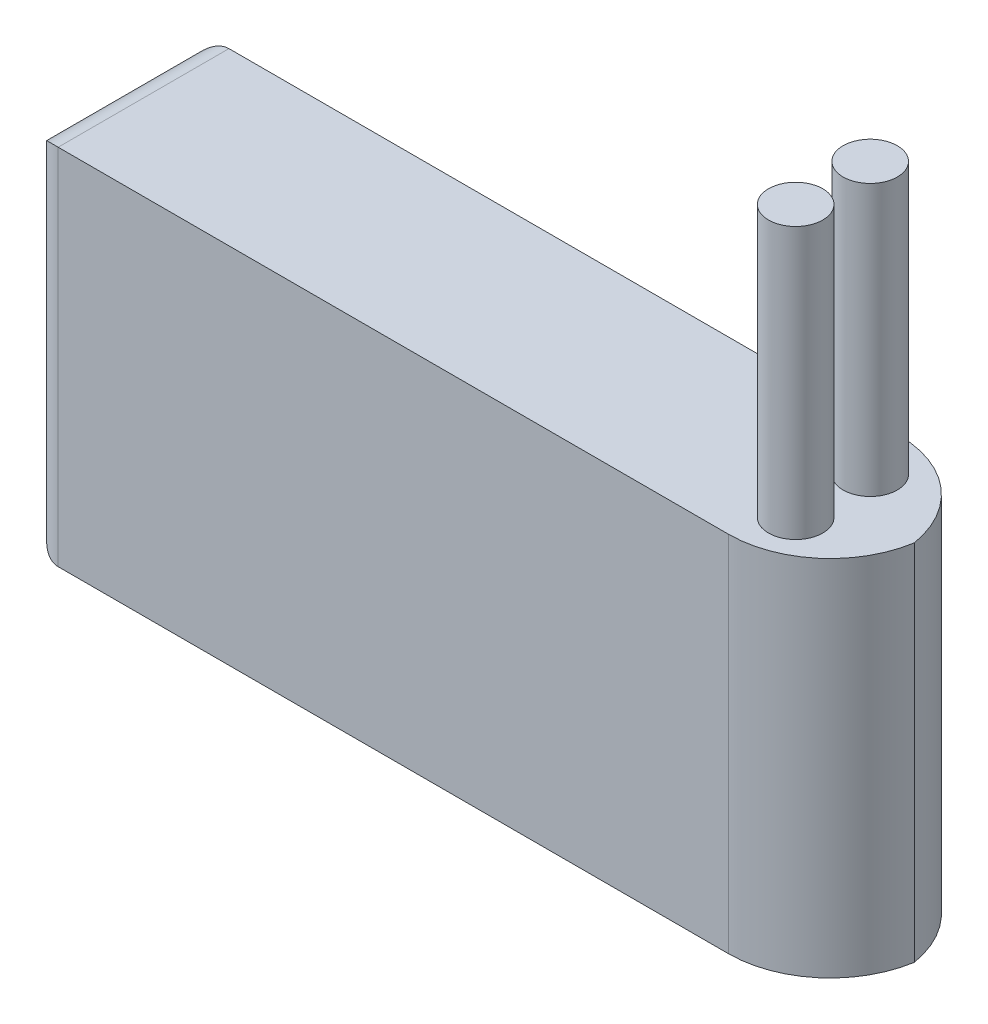
from build123d import *

# Parameters (mm, degrees)
SKETCH1_W           = 74.93
SKETCH1_H           = 34.036
BOSS_EXTRUDE1_DEPTH = 16.002
FILLET1_R           = 9.525
SKETCH2_R           = 2.54
BOSS_EXTRUDE2_DEPTH = 25.4
FILLET2_R           = 2.6035


with BuildPart() as part:
    # Sketch1 → Boss-Extrude1 (new body)
    with BuildSketch(Plane.XY):
        with Locations((37.465, 17.018)):
            Rectangle(SKETCH1_W, SKETCH1_H)
    extrude(amount=BOSS_EXTRUDE1_DEPTH)

    # Fillet1
    # the kernel refuses this fillet: 9.525 mm, written as the material it takes off along each edge
    with BuildSketch(Plane(origin=(74.93, -23.8125, 16.002), x_dir=(0, 0, -1), z_dir=(0, 1, 0))) as fillet1_piece_1:
        with BuildLine():
            CenterArc((FILLET1_R, FILLET1_R), FILLET1_R, 180, 90)
            Line((0, FILLET1_R), (0, 0))
            Line((0, 0), (FILLET1_R, 0))
        make_face()
    extrude(amount=81.661, mode=Mode.SUBTRACT)
    with BuildSketch(Plane(origin=(74.93, -23.8125, 0), x_dir=(0, 0, 1), z_dir=(0, 1, 0))) as fillet1_piece_2:
        with BuildLine():
            CenterArc((FILLET1_R, -FILLET1_R), FILLET1_R, 90, 90)
            Line((0, -FILLET1_R), (0, 0))
            Line((0, 0), (FILLET1_R, 0))
        make_face()
    extrude(amount=81.661, mode=Mode.SUBTRACT)

    # Sketch2 → Boss-Extrude2 (add)
    with BuildSketch(Plane(origin=(0, 34.036, 0), x_dir=(1, 0, 0), z_dir=(0, 1, 0))):
        with Locations(Location((67.187289562, -4.5085, 0), (0, 0, 90))):
            Circle(SKETCH2_R)
        with Locations(Location((67.187289562, -11.4935, 0), (0, 0, 90))):
            Circle(SKETCH2_R)
    extrude(amount=BOSS_EXTRUDE2_DEPTH)

    # Fillet2
    fillet2_edges = [part.edges().sort_by_distance(p)[0] for p in [
        (0, 17.018, 16.002),
        (0, 17.018, 0),
        (0, 34.036, 8.001),
        (0, 0, 8.001),
    ]]
    fillet(fillet2_edges, radius=FILLET2_R)


solid = part.part
